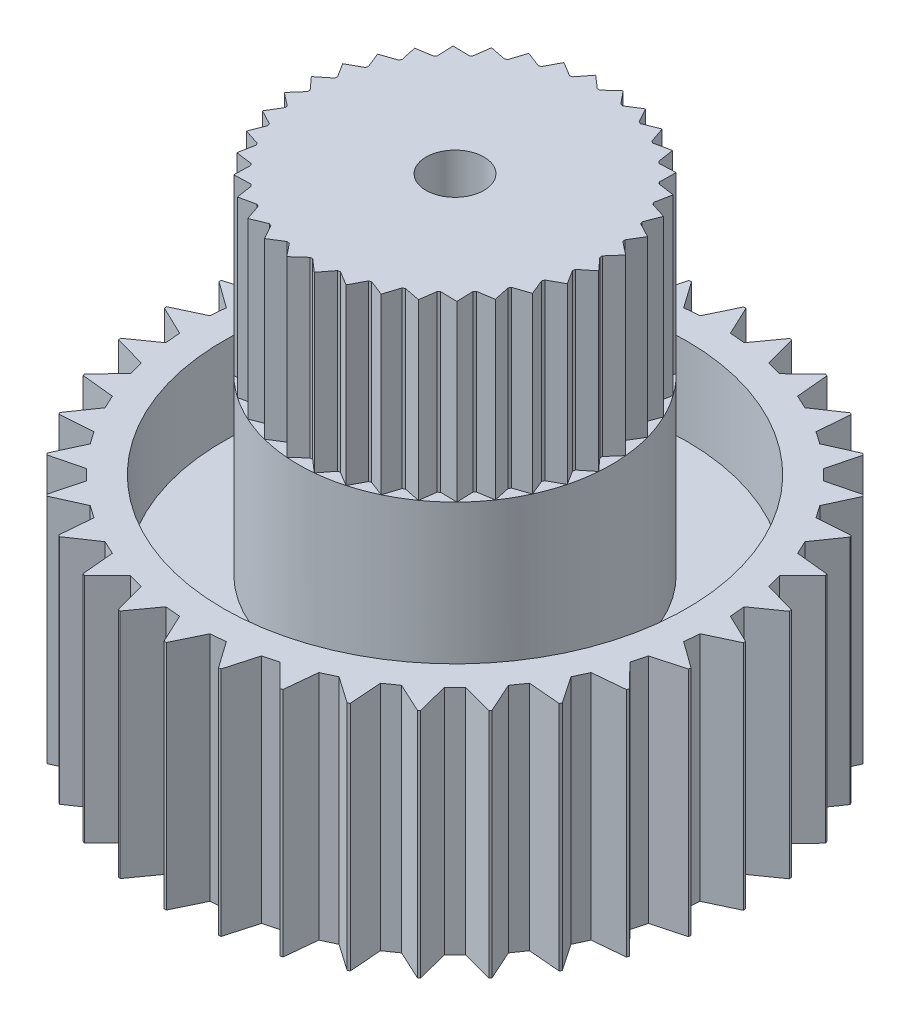
from build123d import *

# Parameters (mm, degrees)
SKETCH2_R           = 5
BOSS_EXTRUDE1_DEPTH = 4
CUT_EXTRUDE1_DEPTH  = 9.124038405
CIRPATTERN1_COUNT   = 36
SKETCH6_R           = 4
CUT_EXTRUDE2_DEPTH  = 1.5
SKETCH7_R           = 0.5
CUT_EXTRUDE3_DEPTH  = 9.124038405
CUT_EXTRUDE4_START  = -1.5
SKETCH8_R           = 4
SKETCH8_R_2         = 1
CUT_EXTRUDE4_DEPTH  = 1.5
SKETCH9_R           = 2.5
BOSS_EXTRUDE2_DEPTH = 6
SKETCH10_R          = 0.5
CUT_EXTRUDE5_DEPTH  = 12.056672194
BOSS_EXTRUDE3_DEPTH = 3
CIRPATTERN2_COUNT   = 36
SKETCH13_R          = 2.7
BOSS_EXTRUDE4_DEPTH = 3


with BuildPart() as part:
    # Sketch2 → Boss-Extrude1 (new body)
    with BuildSketch(Plane(origin=(0, 0, 0), x_dir=(1, 0, 0), z_dir=(0, 1, 0))):
        Circle(SKETCH2_R)
    extrude(amount=BOSS_EXTRUDE1_DEPTH)

    # Sketch4 → Cut-Extrude1 (cut, through all)
    with BuildSketch(Plane(origin=(0, 4, 0), x_dir=(1, 0, 0), z_dir=(0, 1, 0))):
        Polygon((0.26165173, 4.492386712), (0, 5.048851691), (0.874121418, 4.957388906), (0.522418114, 4.46957261), align=None)
    cut_extrude1 = extrude(amount=-CUT_EXTRUDE1_DEPTH, mode=Mode.SUBTRACT)

    # CirPattern1: Cut-Extrude1 ×36 about axis
    cirpattern1_axis = Axis((0, 0, 0), (0, 1, 0))
    for i in range(1, CIRPATTERN1_COUNT):
        add(cut_extrude1.rotate(cirpattern1_axis, i * 360 / CIRPATTERN1_COUNT), mode=Mode.SUBTRACT)

    # Sketch6 → Cut-Extrude2 (cut)
    with BuildSketch(Plane(origin=(0, 4, 0), x_dir=(1, 0, 0), z_dir=(0, 1, 0))):
        Circle(SKETCH6_R)
    extrude(amount=-CUT_EXTRUDE2_DEPTH, mode=Mode.SUBTRACT)

    # Sketch7 → Cut-Extrude3 (cut, through all)
    with BuildSketch(Plane(origin=(0, 4, 0), x_dir=(1, 0, 0), z_dir=(0, 1, 0))):
        Circle(SKETCH7_R)
    extrude(amount=-CUT_EXTRUDE3_DEPTH, mode=Mode.SUBTRACT)

    # Sketch8 → Cut-Extrude4 (cut)
    with BuildSketch(Plane(origin=(0, 0, 0), x_dir=(-1, 0, 0), z_dir=(0, -1, 0)).offset(CUT_EXTRUDE4_START)):
        Circle(SKETCH8_R)
        Circle(SKETCH8_R_2, mode=Mode.SUBTRACT)
    extrude(amount=CUT_EXTRUDE4_DEPTH, mode=Mode.SUBTRACT)

    # Sketch9 → Boss-Extrude2 (add)
    with BuildSketch(Plane(origin=(0, 2.5, 0), x_dir=(1, 0, 0), z_dir=(0, 1, 0))):
        Circle(SKETCH9_R)
    extrude(amount=BOSS_EXTRUDE2_DEPTH)

    # Sketch10 → Cut-Extrude5 (cut, through all)
    with BuildSketch(Plane(origin=(0, 8.5, 0), x_dir=(1, 0, 0), z_dir=(0, 1, 0))):
        Circle(SKETCH10_R)
    extrude(amount=-CUT_EXTRUDE5_DEPTH, mode=Mode.SUBTRACT)

    # Sketch12 → Boss-Extrude3 (add)
    with BuildSketch(Plane(origin=(0, 8.5, 0), x_dir=(1, 0, 0), z_dir=(0, 1, 0))):
        Polygon((2.469220851, -0.391086163), (2.691676801, -0.211839558), (2.5, 0), align=None)
    boss_extrude3 = extrude(amount=-BOSS_EXTRUDE3_DEPTH)

    # CirPattern2: Boss-Extrude3 ×36 about axis
    cirpattern2_axis = Axis((0, 0, 0), (0, 1, 0))
    for i in range(1, CIRPATTERN2_COUNT):
        add(boss_extrude3.rotate(cirpattern2_axis, i * 360 / CIRPATTERN2_COUNT))

    # Sketch13 → Boss-Extrude4 (add)
    with BuildSketch(Plane(origin=(0, 2.5, 0), x_dir=(1, 0, 0), z_dir=(0, 1, 0))):
        Circle(SKETCH13_R)
    extrude(amount=BOSS_EXTRUDE4_DEPTH)


solid = part.part
